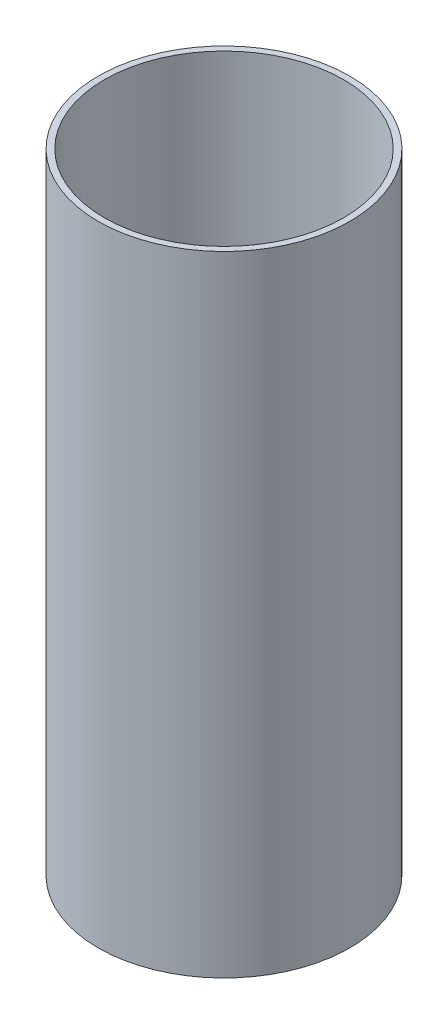
from build123d import *

# Parameters (mm, degrees)
SKETCH1_R   = 25.4
SKETCH1_R_2 = 24.1554
BODY_DEPTH  = 127
SKETCH2_W   = 1.87325
SKETCH2_H   = 1.7272


with BuildPart() as part:
    # Sketch1 → body (new body)
    with BuildSketch(Plane(origin=(0, 0, 0), x_dir=(1, 0, 0), z_dir=(0, 1, 0))):
        Circle(SKETCH1_R)
        Circle(SKETCH1_R_2, mode=Mode.SUBTRACT)
    extrude(amount=BODY_DEPTH)

    # Sketch2 → Cut-Revolve1 (revolve, cut)
    with BuildSketch(Plane.XY):
        with Locations((23.955375, 7.2136)):
            Rectangle(SKETCH2_W, SKETCH2_H)
    revolve(axis=Axis((0, 0, 0), (0, 1, 0)), mode=Mode.SUBTRACT)


solid = part.part
